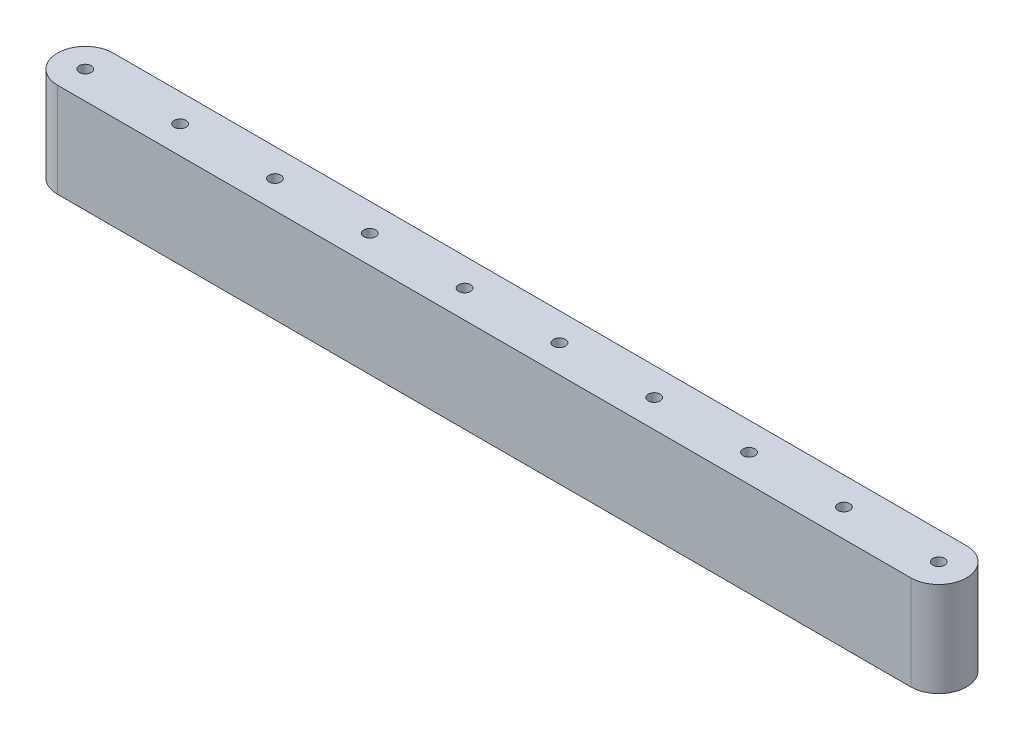
from build123d import *

# Parameters (mm, degrees)
BOSS_EXTRUDE1_DEPTH     = 8.0875
CUT_EXTRUDE1_DEPTH      = 79.351670172
CUT_EXTRUDE1_DEPTH_BACK = 79.351670172
SKETCH2_R               = 1.016


with BuildPart() as part:
    # Sketch1 → Boss-Extrude1 (new, symmetric)
    with BuildSketch(Plane(origin=(0, 0, 0), x_dir=(1, 0, 0), z_dir=(0, 1, 0))):
        with BuildLine():
            Line((-73.025, 4.7625), (73.025, 4.7625))
            ThreePointArc((73.025, 4.7625), (77.7875, 0), (73.025, -4.7625))
            Line((73.025, -4.7625), (-73.025, -4.7625))
            ThreePointArc((-73.025, -4.7625), (-77.7875, 0), (-73.025, 4.7625))
        make_face()
    extrude(amount=BOSS_EXTRUDE1_DEPTH, both=True)

    # Sketch2 → Cut-Extrude1 (cut, two sides: drawn at the far end of the back side and taken through both)
    with BuildSketch(Plane(origin=(0, 0, 0), x_dir=(1, 0, 0), z_dir=(0, 1, 0)).offset(-CUT_EXTRUDE1_DEPTH_BACK)):
        with Locations((-73.025, 0)):
            Circle(SKETCH2_R)
        with Locations((-56.797222222, 0)):
            Circle(SKETCH2_R)
        with Locations((-40.569444444, 0)):
            Circle(SKETCH2_R)
        with Locations((-24.341666667, 0)):
            Circle(SKETCH2_R)
        with Locations((-8.113888889, 0)):
            Circle(SKETCH2_R)
        with Locations((8.113888889, 0)):
            Circle(SKETCH2_R)
        with Locations((24.341666667, 0)):
            Circle(SKETCH2_R)
        with Locations((40.569444444, 0)):
            Circle(SKETCH2_R)
        with Locations((56.797222222, 0)):
            Circle(SKETCH2_R)
        with Locations((73.025, 0)):
            Circle(SKETCH2_R)
    extrude(amount=CUT_EXTRUDE1_DEPTH + CUT_EXTRUDE1_DEPTH_BACK, mode=Mode.SUBTRACT)


solid = part.part
